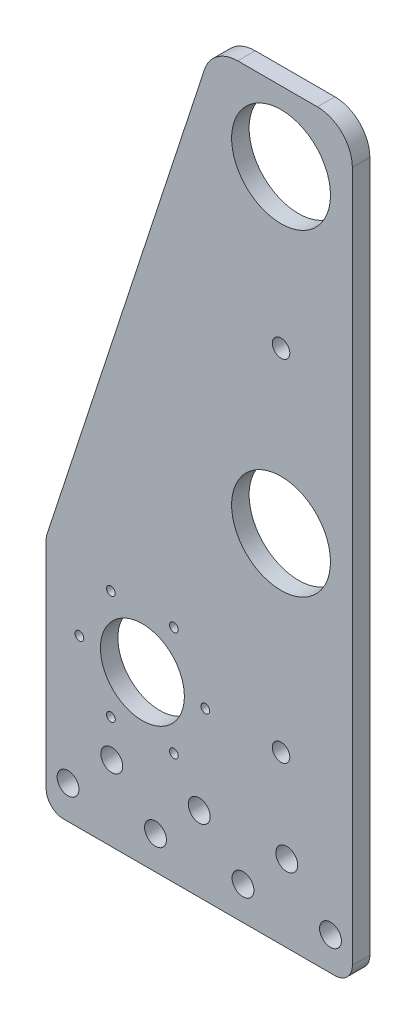
from build123d import *

# Parameters (mm, degrees)
SKETCH1_R           = 14.351
SKETCH1_R_2         = 2.54
SKETCH1_R_3         = 12.192
SKETCH1_R_4         = 3.175
SKETCH1_R_5         = 1.27
BOSS_EXTRUDE1_DEPTH = 5.08


with BuildPart() as part:
    # Sketch1 → Boss-Extrude1 (new body)
    with BuildSketch(Plane.XY):
        with BuildLine():
            Line((88.9, 205.74), (88.9, 5.08))
            ThreePointArc((88.9, 5.08), (87.412102448, 1.487897552), (83.82, 0))
            Line((83.82, 0), (5.08, 0))
            ThreePointArc((5.08, 0), (1.487897552, 1.487897552), (0, 5.08))
            Line((0, 5.08), (0, 67.619993162))
            ThreePointArc((0, 67.619993162), (0.063384098, 68.419971217), (0.25195468, 69.199986324))
            Line((0.25195468, 69.199986324), (45.969223296, 208.899986324))
            ThreePointArc((45.969223296, 208.899986324), (49.662087504, 213.965906061), (55.625313935, 215.9))
            Line((55.625313935, 215.9), (78.74, 215.9))
            ThreePointArc((78.74, 215.9), (85.924204897, 212.924204897), (88.9, 205.74))
        make_face()
        with Locations((68.199, 195.58)):
            Circle(SKETCH1_R, mode=Mode.SUBTRACT)
        with Locations((68.199, 103.378)):
            Circle(SKETCH1_R, mode=Mode.SUBTRACT)
        with Locations((68.199, 149.95398)):
            Circle(SKETCH1_R_2, mode=Mode.SUBTRACT)
        with Locations((68.199, 48.35398)):
            Circle(SKETCH1_R_2, mode=Mode.SUBTRACT)
        with Locations((27.94, 48.35398)):
            Circle(SKETCH1_R_3, mode=Mode.SUBTRACT)
        with Locations((6.35, 9.652)):
            Circle(SKETCH1_R_4, mode=Mode.SUBTRACT)
        with Locations((31.75, 9.652)):
            Circle(SKETCH1_R_4, mode=Mode.SUBTRACT)
        with Locations((57.15, 9.652)):
            Circle(SKETCH1_R_4, mode=Mode.SUBTRACT)
        with Locations((82.55, 9.652)):
            Circle(SKETCH1_R_4, mode=Mode.SUBTRACT)
        with Locations((69.85, 22.352)):
            Circle(SKETCH1_R_4, mode=Mode.SUBTRACT)
        with Locations((44.45, 21.844)):
            Circle(SKETCH1_R_4, mode=Mode.SUBTRACT)
        with Locations((19.05, 21.844)):
            Circle(SKETCH1_R_4, mode=Mode.SUBTRACT)
        with Locations((46.228, 48.35398)):
            Circle(SKETCH1_R_5, mode=Mode.SUBTRACT)
        with Locations((37.084, 32.516107416)):
            Circle(SKETCH1_R_5, mode=Mode.SUBTRACT)
        with Locations((18.796, 32.516107416)):
            Circle(SKETCH1_R_5, mode=Mode.SUBTRACT)
        with Locations((9.652, 48.35398)):
            Circle(SKETCH1_R_5, mode=Mode.SUBTRACT)
        with Locations((18.796, 64.191852584)):
            Circle(SKETCH1_R_5, mode=Mode.SUBTRACT)
        with Locations((37.084, 64.191852584)):
            Circle(SKETCH1_R_5, mode=Mode.SUBTRACT)
    extrude(amount=BOSS_EXTRUDE1_DEPTH)


solid = part.part
